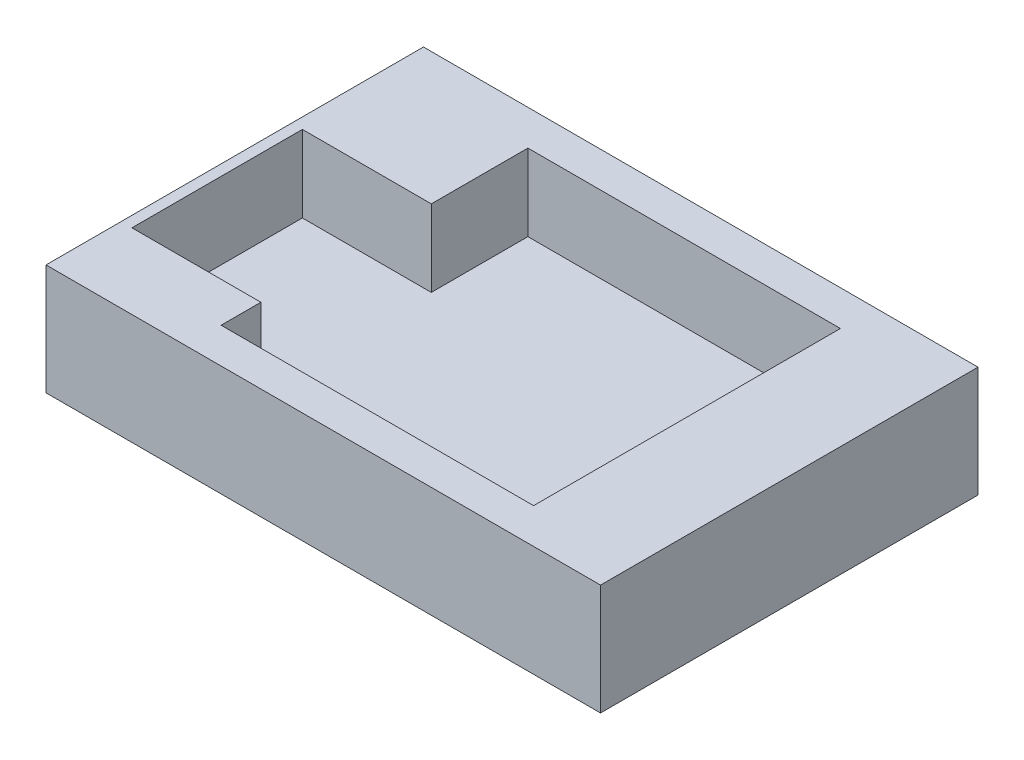
from build123d import *

# Parameters (mm, degrees)
SKETCH1_W           = 97.6
SKETCH1_H           = 66.43745389
BOSS_EXTRUDE1_DEPTH = 6
SKETCH4_W           = 97.6
SKETCH4_H           = 66.43745389
SKETCH4_W_2         = 55
SKETCH4_H_2         = 54
BOSS_EXTRUDE2_DEPTH = 13.5
SKETCH5_W           = 34.693830492
SKETCH5_H           = 30
CUT_EXTRUDE1_DEPTH  = 13.5


with BuildPart() as part:
    # Sketch1 → Boss-Extrude1 (new body)
    with BuildSketch(Plane(origin=(0, 0, 0), x_dir=(1, 0, 0), z_dir=(0, 1, 0))):
        Rectangle(SKETCH1_W, SKETCH1_H)
    extrude(amount=BOSS_EXTRUDE1_DEPTH)

    # Sketch4 → Boss-Extrude2 (add)
    with BuildSketch(Plane(origin=(0, 6, 0), x_dir=(1, 0, 0), z_dir=(0, 1, 0))):
        Rectangle(SKETCH4_W, SKETCH4_H)
        with Locations((3.3, 0)):
            Rectangle(SKETCH4_W_2, SKETCH4_H_2, mode=Mode.SUBTRACT)
    extrude(amount=BOSS_EXTRUDE2_DEPTH)

    # Sketch5 → Cut-Extrude1 (cut)
    with BuildSketch(Plane(origin=(0, 19.5, 0), x_dir=(1, 0, 0), z_dir=(0, 1, 0))):
        with Locations((-29.546650011, -5)):
            Rectangle(SKETCH5_W, SKETCH5_H)
    extrude(amount=-CUT_EXTRUDE1_DEPTH, mode=Mode.SUBTRACT)


solid = part.part
